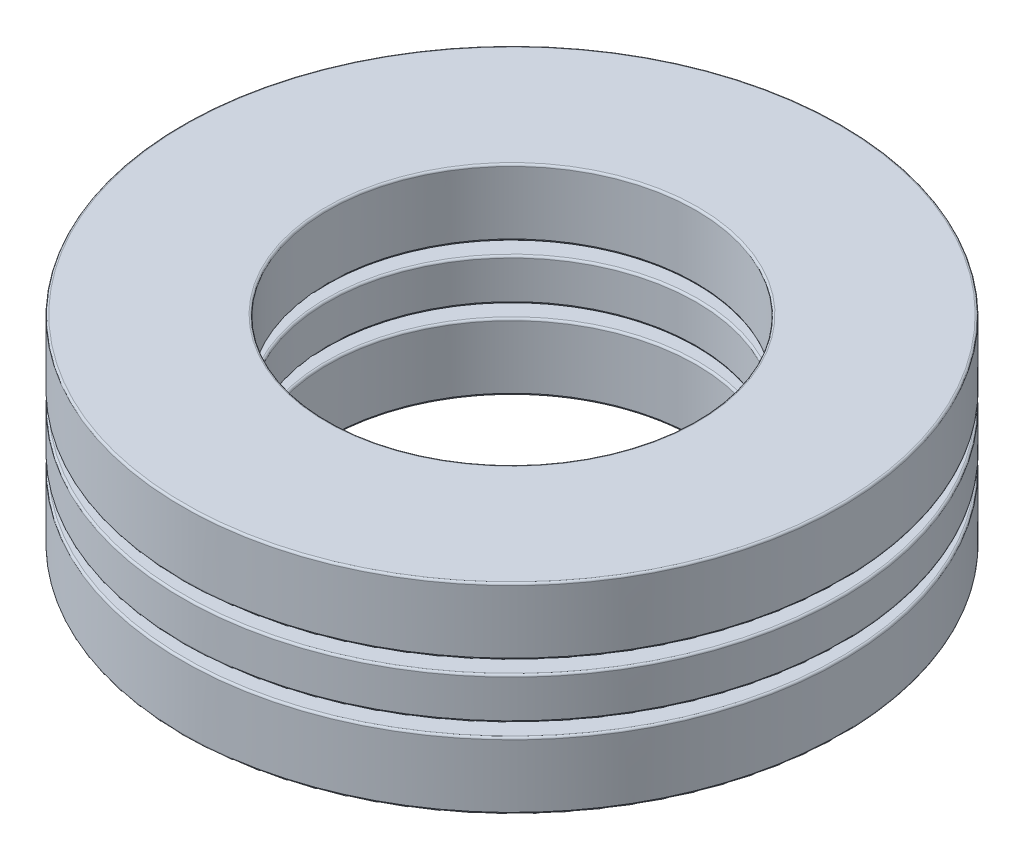
from build123d import *

# Parameters (mm, degrees)
SKETCH1_W         = 6.3119
SKETCH1_H         = 1.80975
CIRPATTERN1_COUNT = 6
CIRPATTERN1_ANGLE = 300
CIRPATTERN2_COUNT = 6
SKETCH4_W         = 6.3119
SKETCH4_H         = 2.8956
FILLET1_R         = 0.086868
FILLET2_R         = 0.086868
FILLET3_R         = 0.086868


with BuildPart() as part:
    # Sketch1 → Revolve1 (revolve)
    with BuildSketch(Plane(origin=(0, 0, 0), x_dir=(0, 0, -1), z_dir=(1, 0, 0))):
        with Locations((-11.13155, 0)):
            Rectangle(SKETCH1_W, SKETCH1_H)
    revolve(axis=Axis((0, -4.3434, 0), (0, 1, 0)))

    # Sketch3 → Cut-Revolve1 (revolve, cut)
    with BuildSketch(Plane(origin=(0, 0, 0), x_dir=(0, 0, -1), z_dir=(1, 0, 0))):
        with BuildLine():
            Line((-11.13155, 1.4478), (-11.13155, -1.4478))
            ThreePointArc((-11.13155, -1.4478), (-12.57935, 0), (-11.13155, 1.4478))
        make_face()
    cut_revolve1 = revolve(axis=Axis((0, 1.4478, 11.13155), (0, -1, 0)), mode=Mode.SUBTRACT)

    # CirPattern2: Cut-Revolve1 ×6 about axis
    cirpattern2_axis = Axis((0, 4.3434, 0), (0, -1, 0))
    for i in range(1, CIRPATTERN2_COUNT):
        add(cut_revolve1.rotate(cirpattern2_axis, i * 360 / CIRPATTERN2_COUNT), mode=Mode.SUBTRACT)

    # Fillet2
    fillet2_edges = [part.edges().sort_by_distance(p)[0] for p in [
        (0, -0.904875, -7.9756),
        (0, 0.904875, -7.9756),
        (0, -0.904875, -14.2875),
        (0, 0.904875, -14.2875),
    ]]
    fillet(fillet2_edges, radius=FILLET2_R)


with BuildPart() as body_2:
    # Sketch2 → Revolve2 (revolve)
    with BuildSketch(Plane(origin=(0, 0, 0), x_dir=(0, 0, -1), z_dir=(1, 0, 0))):
        with BuildLine():
            Line((-11.13155, 1.4478), (-11.13155, -1.4478))
            ThreePointArc((-11.13155, -1.4478), (-12.57935, 0), (-11.13155, 1.4478))
        make_face()
    revolve(axis=Axis((0, 1.4478, 11.13155), (0, -1, 0)))


with BuildPart() as cirpattern1_1:
    # CirPattern1: pattern copy
    add(body_2.part.rotate(Axis((0, 4.3434, 0), (0, -1, 0)), 1 * CIRPATTERN1_ANGLE / (CIRPATTERN1_COUNT - 1)))


with BuildPart() as cirpattern1_2:
    # CirPattern1: pattern copy
    add(body_2.part.rotate(Axis((0, 4.3434, 0), (0, -1, 0)), 2 * CIRPATTERN1_ANGLE / (CIRPATTERN1_COUNT - 1)))


with BuildPart() as cirpattern1_3:
    # CirPattern1: pattern copy
    add(body_2.part.rotate(Axis((0, 4.3434, 0), (0, -1, 0)), 3 * CIRPATTERN1_ANGLE / (CIRPATTERN1_COUNT - 1)))


with BuildPart() as cirpattern1_4:
    # CirPattern1: pattern copy
    add(body_2.part.rotate(Axis((0, 4.3434, 0), (0, -1, 0)), 4 * CIRPATTERN1_ANGLE / (CIRPATTERN1_COUNT - 1)))


with BuildPart() as cirpattern1_5:
    # CirPattern1: pattern copy
    add(body_2.part.rotate(Axis((0, 4.3434, 0), (0, -1, 0)), 5 * CIRPATTERN1_ANGLE / (CIRPATTERN1_COUNT - 1)))


with BuildPart() as body_8:
    # Sketch4 → Revolve3 (revolve)
    with BuildSketch(Plane(origin=(0, 0, 0), x_dir=(0, 0, -1), z_dir=(1, 0, 0))):
        with Locations((-11.13155, 2.8956)):
            Rectangle(SKETCH4_W, SKETCH4_H)
        with Locations((-11.13155, -2.8956)):
            Rectangle(SKETCH4_W, SKETCH4_H)
    revolve(axis=Axis((0, -4.3434, 0), (0, 1, 0)))

    # Fillet1
    fillet1_edges = [body_8.edges().sort_by_distance(p)[0] for p in [
        (0, 1.4478, -7.9756),
        (0, 4.3434, -7.9756),
        (0, 1.4478, -14.2875),
        (0, 4.3434, -14.2875),
    ]]
    fillet(fillet1_edges, radius=FILLET1_R)

    # Fillet3
    fillet3_edges = [body_8.edges().sort_by_distance(p)[0] for p in [
        (0, -4.3434, -7.9756),
        (0, -1.4478, -7.9756),
        (0, -4.3434, -14.2875),
        (0, -1.4478, -14.2875),
    ]]
    fillet(fillet3_edges, radius=FILLET3_R)


solid = Compound([part.part, body_2.part, cirpattern1_1.part, cirpattern1_2.part, cirpattern1_3.part, cirpattern1_4.part, cirpattern1_5.part, body_8.part])
